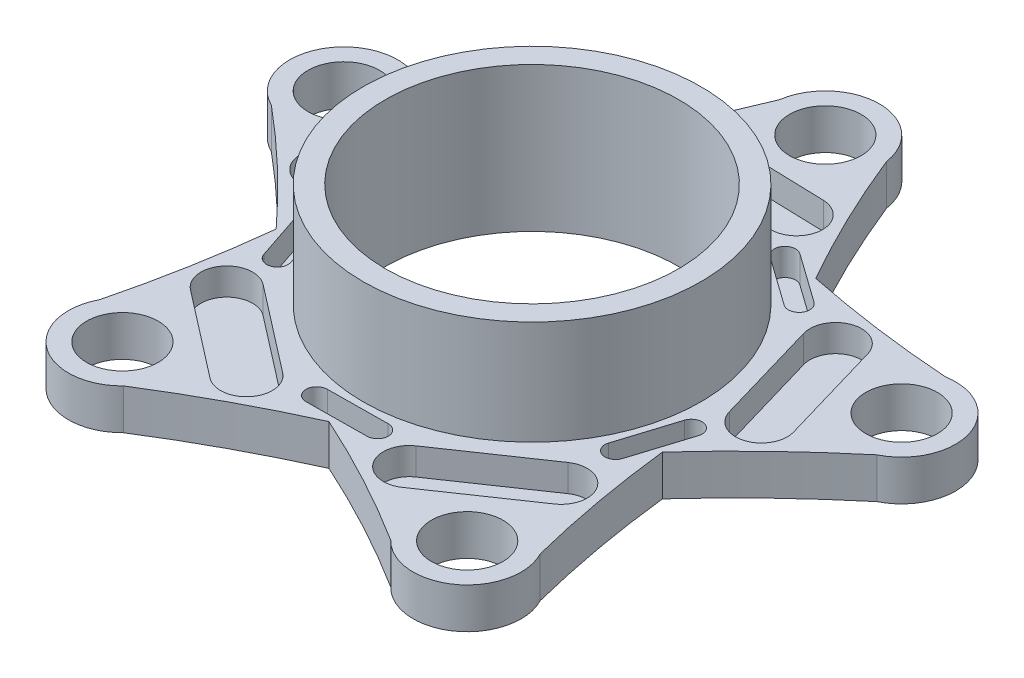
from build123d import *

# Parameters (mm, degrees)
SKETCH1_R                 = 31.75
CENTERCIRCLEEXTRUDE_DEPTH = 19.558
SKETCH2_R                 = 80.01
BASEEXPAND_DEPTH          = 7.62
SKETCH3_R                 = 27.559
CENTERCUT_DEPTH           = 27.178
SKETCH4_R                 = 6.731
OUTERCIRCLECUT_DEPTH      = 7.62
SKETCH8_R                 = 80.01
STARFISHCUT_DEPTH         = 7.62
BATMAN_CUT_DEPTH          = 5.08


with BuildPart() as part:
    # Sketch1 → CenterCircleExtrude (new body)
    with BuildSketch(Plane(origin=(0, 0, 0), x_dir=(1, 0, 0), z_dir=(0, 1, 0))):
        Circle(SKETCH1_R)
    extrude(amount=CENTERCIRCLEEXTRUDE_DEPTH)

    # Sketch2 → BaseExpand (add)
    with BuildSketch(Plane.XZ):
        Circle(SKETCH2_R)
    extrude(amount=BASEEXPAND_DEPTH)

    # Sketch3 → CenterCut (cut)
    with BuildSketch(Plane(origin=(0, 19.558, 0), x_dir=(1, 0, 0), z_dir=(0, 1, 0))):
        Circle(SKETCH3_R)
    extrude(amount=-CENTERCUT_DEPTH, mode=Mode.SUBTRACT)

    # Sketch4 → OuterCircleCut (cut)
    with BuildSketch(Plane(origin=(0, 0, 0), x_dir=(1, 0, 0), z_dir=(0, 1, 0))):
        with Locations((0, 55.118)):
            Circle(SKETCH4_R)
        with Locations((52.420333065, 17.032398696)):
            Circle(SKETCH4_R)
        with Locations((32.397547536, -44.591398696)):
            Circle(SKETCH4_R)
        with Locations((-32.397547536, -44.591398696)):
            Circle(SKETCH4_R)
        with Locations((-52.420333065, 17.032398696)):
            Circle(SKETCH4_R)
    extrude(amount=-OUTERCIRCLECUT_DEPTH, mode=Mode.SUBTRACT)

    # Sketch8 → StarfishCut (cut)
    with BuildSketch(Plane(origin=(0, 0, 0), x_dir=(1, 0, 0), z_dir=(0, 1, 0))):
        Circle(SKETCH8_R)
        with BuildLine():
            ThreePointArc((-60.451485692, 10.809361858), (-62.083067271, 20.172011359), (-55.259862746, 26.787534327))
            ThreePointArc((-55.259862746, 26.787534327), (-52.990125634, 27.176408575), (-50.691117004, 27.044162367))
            ThreePointArc((-50.691117004, 27.044162367), (-36.498445494, 28.482280038), (-22.436174146, 30.88074446))
            ThreePointArc((-22.436174146, 30.88074446), (-15.809618103, 43.513592992), (-10.056110229, 56.567222915))
            ThreePointArc((-10.056110229, 56.567222915), (-9.47145111, 58.794576379), (-8.400222382, 60.833055899))
            ThreePointArc((-8.400222382, 60.833055899), (0, 65.278), (8.400222382, 60.833055899))
            ThreePointArc((8.400222382, 60.833055899), (9.47145111, 58.794576379), (10.056110229, 56.567222915))
            ThreePointArc((10.056110229, 56.567222915), (15.809618103, 43.513592992), (22.436174146, 30.88074446))
            ThreePointArc((22.436174146, 30.88074446), (36.498445494, 28.482280038), (50.691117004, 27.044162367))
            ThreePointArc((50.691117004, 27.044162367), (52.990125634, 27.176408575), (55.259862746, 26.787534327))
            ThreePointArc((55.259862746, 26.787534327), (60.546685924, 23.130594267), (62.580333065, 17.032398696))
            ThreePointArc((62.580333065, 17.032398696), (62.033399971, 13.743851196), (60.451485692, 10.809361858))
            ThreePointArc((60.451485692, 10.809361858), (58.843804343, 9.160637981), (56.90613492, 7.916304043))
            ThreePointArc((56.90613492, 7.916304043), (46.26932683, -1.589400596), (36.302492346, -11.795394786))
            ThreePointArc((36.302492346, -11.795394786), (38.366897955, -25.910575851), (41.384943465, -39.853011375))
            ThreePointArc((41.384943465, -39.853011375), (42.22114982, -41.998632188), (42.552695773, -44.27744921))
            ThreePointArc((42.552695773, -44.27744921), (42.556334523, -44.434405209), (42.557547536, -44.591398696))
            ThreePointArc((42.557547536, -44.591398696), (38.241722309, -52.902308467), (28.960850446, -54.152502874))
            ThreePointArc((28.960850446, -54.152502874), (26.896020001, -53.132990748), (25.11381532, -51.674677951))
            ThreePointArc((25.11381532, -51.674677951), (12.786398515, -44.495896582), (0, -38.170699348))
            ThreePointArc((0, -38.170699348), (-12.786398515, -44.495896582), (-25.11381532, -51.674677951))
            ThreePointArc((-25.11381532, -51.674677951), (-26.896020001, -53.132990748), (-28.960850446, -54.152502874))
            ThreePointArc((-28.960850446, -54.152502874), (-38.369445699, -52.811011359), (-42.552695773, -44.27744921))
            ThreePointArc((-42.552695773, -44.27744921), (-42.22114982, -41.998632188), (-41.384943465, -39.853011375))
            ThreePointArc((-41.384943465, -39.853011375), (-38.366897955, -25.910575851), (-36.302492346, -11.795394786))
            ThreePointArc((-36.302492346, -11.795394786), (-46.26932683, -1.589400596), (-56.90613492, 7.916304043))
            ThreePointArc((-56.90613492, 7.916304043), (-58.843804343, 9.160637981), (-60.451485692, 10.809361858))
        make_face(mode=Mode.SUBTRACT)
    extrude(amount=-STARFISHCUT_DEPTH, mode=Mode.SUBTRACT)

    # Sketch14 → Batman Cut (cut)
    with BuildSketch(Plane(origin=(0, 0, 0), x_dir=(1, 0, 0), z_dir=(0, 1, 0))):
        with BuildLine():
            Line((-33.120038048, -5.061770157), (-29.510136252, -15.81140749))
            ThreePointArc((-29.510136252, -15.81140749), (-30.777930128, -18.361212827), (-33.327735465, -17.093418951))
            Line((-33.327735465, -17.093418951), (-36.937637261, -6.343781617))
            ThreePointArc((-36.937637261, -6.343781617), (-35.669843385, -3.793976281), (-33.120038048, -5.061770157))
        make_face()
        with BuildLine():
            Line((-15.048684103, 29.934855006), (-24.156675734, 23.17981376))
            ThreePointArc((-24.156675734, 23.17981376), (-26.973454567, 23.597624206), (-26.555644121, 26.414403039))
            Line((-26.555644121, 26.414403039), (-17.447652491, 33.169444285))
            ThreePointArc((-17.447652491, 33.169444285), (-14.630873657, 32.751633839), (-15.048684103, 29.934855006))
        make_face()
        with BuildLine():
            Line((23.819439787, 23.562527999), (14.580489593, 30.137320247))
            ThreePointArc((14.580489593, 30.137320247), (14.107418412, 32.94534664), (16.915444805, 33.418417821))
            Line((16.915444805, 33.418417821), (26.154394998, 26.843625573))
            ThreePointArc((26.154394998, 26.843625573), (26.62746618, 24.03559918), (23.819439787, 23.562527999))
        make_face()
        with BuildLine():
            Line((29.769907484, -15.372411842), (33.167913875, -4.553925517))
            ThreePointArc((33.167913875, -4.553925517), (35.692318639, -3.236280211), (37.009963945, -5.760684975))
            Line((37.009963945, -5.760684975), (33.611957554, -16.5791713))
            ThreePointArc((33.611957554, -16.5791713), (31.08755279, -17.896816606), (29.769907484, -15.372411842))
        make_face()
        with BuildLine():
            Line((-5.42062512, -33.063201006), (5.918408517, -32.951800999))
            ThreePointArc((5.918408517, -32.951800999), (7.951647645, -34.945477807), (5.957970836, -36.978716935))
            Line((5.957970836, -36.978716935), (-5.381062801, -37.090116942))
            ThreePointArc((-5.381062801, -37.090116942), (-7.414301928, -35.096440133), (-5.42062512, -33.063201006))
        make_face()
        with BuildLine():
            Line((-28.525313555, -22.027493495), (-12.265879706, -34.597736013))
            ThreePointArc((-12.265879706, -34.597736013), (-11.392472024, -41.423096527), (-18.217832537, -42.29650421))
            Line((-18.217832537, -42.29650421), (-34.477266386, -29.726261691))
            ThreePointArc((-34.477266386, -29.726261691), (-35.350674069, -22.900901178), (-28.525313555, -22.027493495))
        make_face()
        with BuildLine():
            Line((-29.764197885, 20.322315503), (-36.694767565, 0.974256428))
            ThreePointArc((-36.694767565, 0.974256428), (-42.91617334, -1.965556032), (-45.8559858, 4.255849744))
            Line((-45.8559858, 4.255849744), (-38.925416119, 23.603908818))
            ThreePointArc((-38.925416119, 23.603908818), (-32.704010344, 26.543721278), (-29.764197885, 20.322315503))
        make_face()
        with BuildLine():
            Line((10.130027615, 34.587375206), (-10.412733858, 35.1998596))
            ThreePointArc((-10.412733858, 35.1998596), (-15.131181768, 40.208316093), (-10.122725275, 44.926764002))
            Line((-10.122725275, 44.926764002), (10.420036198, 44.314279608))
            ThreePointArc((10.420036198, 44.314279608), (15.138484108, 39.305823116), (10.130027615, 34.587375206))
        make_face()
        with BuildLine():
            Line((36.024899257, 1.053857956), (30.259344125, 20.780453204))
            ThreePointArc((30.259344125, 20.780453204), (33.564588718, 26.815662007), (39.599797521, 23.510417414))
            Line((39.599797521, 23.510417414), (45.365352654, 3.783822167))
            ThreePointArc((45.365352654, 3.783822167), (42.060108061, -2.251386637), (36.024899257, 1.053857956))
        make_face()
        with BuildLine():
            Line((12.134584568, -33.93605517), (29.114037004, -22.356833218))
            ThreePointArc((29.114037004, -22.356833218), (35.875238414, -23.635325541), (34.596746091, -30.396526951))
            Line((34.596746091, -30.396526951), (17.617293654, -41.975748902))
            ThreePointArc((17.617293654, -41.975748902), (10.856092244, -40.697256579), (12.134584568, -33.93605517))
        make_face()
    extrude(amount=-BATMAN_CUT_DEPTH, mode=Mode.SUBTRACT)


solid = part.part
